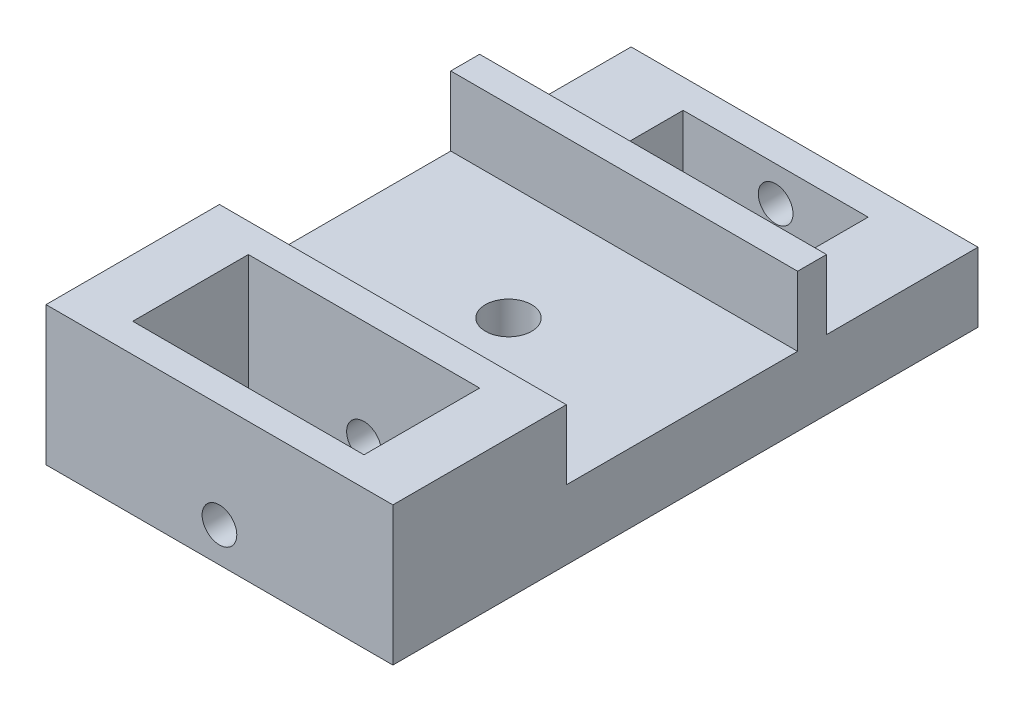
from build123d import *

# Parameters (mm, degrees)
SKETCH1_W           = 30
SKETCH1_H           = 38.1
SKETCH1_W_2         = 16
SKETCH1_H_2         = 10.6
BOSS_EXTRUDE1_DEPTH = 6
SKETCH1_3_W         = 30
SKETCH1_3_H         = 2.5
BOSS_EXTRUDE2_DEPTH = 12
SKETCH3_R           = 1.5
CUT_EXTRUDE2_DEPTH  = 5
CUT_EXTRUDE3_DEPTH  = 2.5
SKETCH2_R           = 2
CUT_EXTRUDE1_DEPTH  = 38.976966704
BOSS_EXTRUDE3_DEPTH = 12
CUT_EXTRUDE4_START  = -20
SKETCH6_R           = 1.5
CUT_EXTRUDE4_DEPTH  = 20


with BuildPart() as part:
    # Sketch1 → Boss-Extrude1 (new body)
    with BuildSketch(Plane(origin=(0, 0, 0), x_dir=(1, 0, 0), z_dir=(0, 1, 0))):
        with Locations((-15, -3.45)):
            Rectangle(SKETCH1_W, SKETCH1_H)
        with Locations((-15, 7.8)):
            Rectangle(SKETCH1_W_2, SKETCH1_H_2, mode=Mode.SUBTRACT)
    extrude(amount=BOSS_EXTRUDE1_DEPTH)

    # Sketch1<3> → Boss-Extrude2 (add)
    with BuildSketch(Plane(origin=(0, 0, 0), x_dir=(1, 0, 0), z_dir=(0, 1, 0))):
        with Locations((-15, -21.25)):
            Rectangle(SKETCH1_3_W, SKETCH1_3_H)
        with Locations((-15, 1.25)):
            Rectangle(SKETCH1_3_W, SKETCH1_3_H)
    extrude(amount=BOSS_EXTRUDE2_DEPTH)

    # Sketch3 → Cut-Extrude2 (cut)
    with BuildSketch(Plane(origin=(0, 0, -15.6), x_dir=(-1, 0, 0), z_dir=(0, 0, -1))):
        with Locations((15, 3)):
            Circle(SKETCH3_R)
    extrude(amount=-CUT_EXTRUDE2_DEPTH, mode=Mode.SUBTRACT)

    # Sketch4 → Cut-Extrude3 (cut)
    with BuildSketch(Plane(origin=(0, 0, -2.5), x_dir=(-1, 0, 0), z_dir=(0, 0, -1))):
        Polygon((16.443375673, 0.5), (17.886751346, 3), (16.443375673, 5.5), (13.556624327, 5.5), (12.113248654, 3), (13.556624327, 0.5), align=None)
    extrude(amount=-CUT_EXTRUDE3_DEPTH, mode=Mode.SUBTRACT)

    # Sketch2 → Cut-Extrude1 (cut, through all)
    with BuildSketch(Plane(origin=(0, 6, 0), x_dir=(1, 0, 0), z_dir=(0, 1, 0))):
        with Locations((-15, -10)):
            Circle(SKETCH2_R)
    extrude(amount=-CUT_EXTRUDE1_DEPTH, mode=Mode.SUBTRACT)

    # Sketch5 → Boss-Extrude3 (add)
    with BuildSketch(Plane.XZ):
        Polygon((-30, 22.5), (-25, 22.5), (-25, 32.5), (-5, 32.5), (-5, 22.5), (0, 22.5), (0, 35), (-30, 35), align=None)
    extrude(amount=-BOSS_EXTRUDE3_DEPTH)

    # Sketch6 → Cut-Extrude4 (cut)
    with BuildSketch(Plane.XY.offset(35).offset(CUT_EXTRUDE4_START)):
        with Locations((-15, 3)):
            Circle(SKETCH6_R)
    extrude(amount=CUT_EXTRUDE4_DEPTH, mode=Mode.SUBTRACT)


solid = part.part
